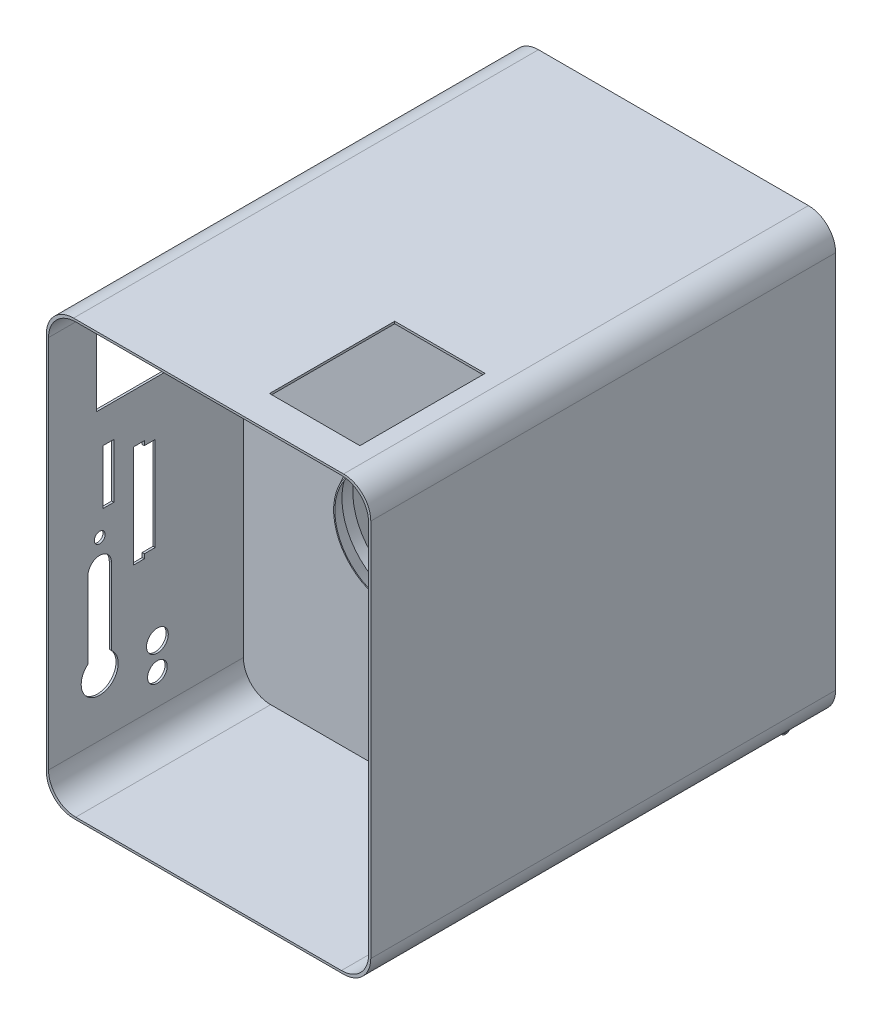
from build123d import *

# Parameters (mm, degrees)
BOSS_EXTRUDE1_DEPTH = 108.458
CUT_EXTRUDE1_DEPTH  = 108.458
BOSS_EXTRUDE2_DEPTH = 2.54
SKETCH4_R           = 14.351
CUT_EXTRUDE2_DEPTH  = 90.191983362
CUT_EXTRUDE3_REACH  = 155.02
SKETCH7_W           = 21.082
SKETCH7_H           = 29.21
CUT_EXTRUDE4_REACH  = 143.589
SKETCH8_W           = 29.21
SKETCH8_H           = 21.082
CUT_EXTRUDE5_REACH  = 143.589
SKETCH9_W           = 2.54
SKETCH9_H           = 12.7
SKETCH9_R           = 1.27
SKETCH9_R_2         = 2.286
SKETCH9_R_3         = 2.54
SKETCH12_R          = 1.27
BOSS_EXTRUDE3_DEPTH = 75.692
SKETCH13_W          = 7.0582536
SKETCH13_H          = 4.079848454
SKETCH13_W_2        = 7.112
SKETCH13_W_3        = 6.949562238
CUT_EXTRUDE11_DEPTH = 12.7
SKETCH15_R          = 1.016
CUT_EXTRUDE12_DEPTH = 140.500120645


# Read off the part's stored shape, not the designer's step: Loft-Thin1
with BuildPart() as part:
    # Sketch1 → Boss-Extrude1 (new body)
    with BuildSketch(Plane.XY):
        with BuildLine():
            Line((-31.496, -50.546), (31.496, -50.546))
            ThreePointArc((31.496, -50.546), (35.986128061, -48.686128061), (37.846, -44.196))
            Line((37.846, -44.196), (37.846, 44.196))
            ThreePointArc((37.846, 44.196), (35.986128061, 48.686128061), (31.496, 50.546))
            Line((31.496, 50.546), (-31.496, 50.546))
            ThreePointArc((-31.496, 50.546), (-35.986128061, 48.686128061), (-37.846, 44.196))
            Line((-37.846, 44.196), (-37.846, -44.196))
            ThreePointArc((-37.846, -44.196), (-35.986128061, -48.686128061), (-31.496, -50.546))
        make_face()
    extrude(amount=-BOSS_EXTRUDE1_DEPTH)

    # Sketch2 → Cut-Extrude1 (cut)
    with BuildSketch(Plane.XY):
        with BuildLine():
            Line((-30.988, -50.038), (30.988, -50.038))
            ThreePointArc((30.988, -50.038), (35.478128061, -48.178128061), (37.338, -43.688))
            Line((37.338, -43.688), (37.338, 43.688))
            ThreePointArc((37.338, 43.688), (35.478128061, 48.178128061), (30.988, 50.038))
            Line((30.988, 50.038), (-30.988, 50.038))
            ThreePointArc((-30.988, 50.038), (-35.478128061, 48.178128061), (-37.338, 43.688))
            Line((-37.338, 43.688), (-37.338, -43.688))
            ThreePointArc((-37.338, -43.688), (-35.478128061, -48.178128061), (-30.988, -50.038))
        make_face()
    extrude(amount=-CUT_EXTRUDE1_DEPTH, mode=Mode.SUBTRACT)

    # Sketch3 → Boss-Extrude2 (add)
    with BuildSketch(Plane.XY.offset(-45.466)):
        with BuildLine():
            Line((-30.988, -50.038), (30.988, -50.038))
            ThreePointArc((30.988, -50.038), (35.478128061, -48.178128061), (37.338, -43.688))
            Line((37.338, -43.688), (37.338, 43.688))
            ThreePointArc((37.338, 43.688), (35.478128061, 48.178128061), (30.988, 50.038))
            Line((30.988, 50.038), (-30.988, 50.038))
            ThreePointArc((-30.988, 50.038), (-35.478128061, 48.178128061), (-37.338, 43.688))
            Line((-37.338, 43.688), (-37.338, -43.688))
            ThreePointArc((-37.338, -43.688), (-35.478128061, -48.178128061), (-30.988, -50.038))
        make_face()
    extrude(amount=-BOSS_EXTRUDE2_DEPTH)

    # Sketch4 → Cut-Extrude2 (cut, through all)
    with BuildSketch(Plane.XY.offset(-45.466)):
        Circle(SKETCH4_R)
    extrude(amount=-CUT_EXTRUDE2_DEPTH, mode=Mode.SUBTRACT)

    # Loft-Thin1 outline → Loft-Thin1 (revolve)
    with BuildSketch(Plane.XZ):
        Polygon((12.983980633, -42.164), (12.7, -42.164), (14.351, -45.466), (14.634980633, -45.466), align=None)
    revolve(axis=Axis((0, 0, 0), (0, 0, 1)))

    # Sketch7 → Cut-Extrude3 (cut, up to next)
    with BuildSketch(Plane(origin=(0, 50.546, 0), x_dir=(1, 0, 0), z_dir=(0, 1, 0)), mode=Mode.PRIVATE) as cut_extrude3_sk1:
        with Locations((17.145, 22.225)):
            Rectangle(SKETCH7_W, SKETCH7_H)
    cut_extrude3_tool1 = extrude(cut_extrude3_sk1.sketch, amount=-CUT_EXTRUDE3_REACH, mode=Mode.PRIVATE) & part.part
    add(cut_extrude3_tool1.solids().sort_by_distance((17.145, 50.546, -22.225))[0], mode=Mode.SUBTRACT)

    # Sketch8 → Cut-Extrude4 (cut, up to next)
    with BuildSketch(Plane.ZY.offset(37.846), mode=Mode.PRIVATE) as cut_extrude4_sk1:
        with Locations((-25.781, 33.655)):
            Rectangle(SKETCH8_W, SKETCH8_H)
    cut_extrude4_tool1 = extrude(cut_extrude4_sk1.sketch, amount=-CUT_EXTRUDE4_REACH, mode=Mode.PRIVATE) & part.part
    add(cut_extrude4_tool1.solids().sort_by_distance((-37.846, 33.655, -25.781))[0], mode=Mode.SUBTRACT)

    # Sketch9 → Cut-Extrude5 (cut, up to next)
    with BuildSketch(Plane.ZY.offset(37.846), mode=Mode.PRIVATE) as cut_extrude5_sk1:
        with Locations((-13.97, 9.144)):
            Rectangle(SKETCH9_W, SKETCH9_H)
    cut_extrude5_tool1 = extrude(cut_extrude5_sk1.sketch, amount=-CUT_EXTRUDE5_REACH, mode=Mode.PRIVATE) & part.part
    # Sketch9 → Cut-Extrude5 (cut, up to next)
    with BuildSketch(Plane.ZY.offset(37.846), mode=Mode.PRIVATE) as cut_extrude5_sk2:
        Polygon((-24.892, -11.176), (-22.352, -11.176), (-22.352, -12.192), (-19.812, -12.192), (-19.812, 11.684), (-22.352, 11.684), (-22.352, 10.668), (-24.892, 10.668), align=None)
    cut_extrude5_tool2 = extrude(cut_extrude5_sk2.sketch, amount=-CUT_EXTRUDE5_REACH, mode=Mode.PRIVATE) & part.part
    # Sketch9 → Cut-Extrude5 (cut, up to next)
    with BuildSketch(Plane.ZY.offset(37.846), mode=Mode.PRIVATE) as cut_extrude5_sk3:
        with BuildLine():
            Line((-9.201161122, -26.88611423), (-9.201161122, -9.029677755))
            ThreePointArc((-9.201161122, -9.029677755), (-11.938, -6.292838878), (-14.674838878, -9.029677755))
            Line((-14.674838878, -9.029677755), (-14.674838878, -26.88611423))
            ThreePointArc((-14.674838878, -26.88611423), (-14.991287081, -33.279287081), (-8.59811423, -32.962838878))
            ThreePointArc((-8.59811423, -32.962838878), (-7.641106794, -29.799581453), (-9.201161122, -26.88611423))
        make_face()
    cut_extrude5_tool3 = extrude(cut_extrude5_sk3.sketch, amount=-CUT_EXTRUDE5_REACH, mode=Mode.PRIVATE) & part.part
    # Sketch9 → Cut-Extrude5 (cut, up to next)
    with BuildSketch(Plane.ZY.offset(37.846), mode=Mode.PRIVATE) as cut_extrude5_sk4:
        with Locations((-11.938, -2.679677755)):
            Circle(SKETCH9_R)
    cut_extrude5_tool4 = extrude(cut_extrude5_sk4.sketch, amount=-CUT_EXTRUDE5_REACH, mode=Mode.PRIVATE) & part.part
    # Sketch9 → Cut-Extrude5 (cut, up to next)
    with BuildSketch(Plane.ZY.offset(37.846), mode=Mode.PRIVATE) as cut_extrude5_sk5:
        with Locations((-25.4, -36.576)):
            Circle(SKETCH9_R_2)
    cut_extrude5_tool5 = extrude(cut_extrude5_sk5.sketch, amount=-CUT_EXTRUDE5_REACH, mode=Mode.PRIVATE) & part.part
    # Sketch9 → Cut-Extrude5 (cut, up to next)
    with BuildSketch(Plane.ZY.offset(37.846), mode=Mode.PRIVATE) as cut_extrude5_sk6:
        with Locations((-25.4, -30.226)):
            Circle(SKETCH9_R_3)
    cut_extrude5_tool6 = extrude(cut_extrude5_sk6.sketch, amount=-CUT_EXTRUDE5_REACH, mode=Mode.PRIVATE) & part.part
    add(cut_extrude5_tool1.solids().sort_by_distance((-37.846, 9.144, -13.97))[0], mode=Mode.SUBTRACT)
    add(cut_extrude5_tool2.solids().sort_by_distance((-37.846, -0.254, -22.295556))[0], mode=Mode.SUBTRACT)
    add(cut_extrude5_tool3.solids().sort_by_distance((-37.846, -21.416514, -11.938))[0], mode=Mode.SUBTRACT)
    add(cut_extrude5_tool4.solids().sort_by_distance((-37.846, -2.679678, -11.938))[0], mode=Mode.SUBTRACT)
    add(cut_extrude5_tool5.solids().sort_by_distance((-37.846, -36.576, -25.4))[0], mode=Mode.SUBTRACT)
    add(cut_extrude5_tool6.solids().sort_by_distance((-37.846, -30.226, -25.4))[0], mode=Mode.SUBTRACT)


with BuildPart() as body_2:
    # Sketch12 → Boss-Extrude3 (new body)
    with BuildSketch(Plane(origin=(37.846, 0, 0), x_dir=(0, 0, -1), z_dir=(1, 0, 0))):
        with Locations((102.616, -51.816)):
            Circle(SKETCH12_R)
    extrude(amount=-BOSS_EXTRUDE3_DEPTH)

    # Sketch13 → Cut-Extrude11 (cut)
    with BuildSketch(Plane(origin=(0, 0, -108.458), x_dir=(-1, 0, 0), z_dir=(0, 0, -1))):
        with Locations((-35.5331268, -52.585924227)):
            Rectangle(SKETCH13_W, SKETCH13_H)
        with Locations((-21.336, -52.585924227)):
            Rectangle(SKETCH13_W_2, SKETCH13_H)
        with Locations((-7.112, -52.585924227)):
            Rectangle(SKETCH13_W_2, SKETCH13_H)
        with Locations((7.112, -52.585924227)):
            Rectangle(SKETCH13_W_2, SKETCH13_H)
        with Locations((21.336, -52.585924227)):
            Rectangle(SKETCH13_W_2, SKETCH13_H)
        with Locations((35.478781119, -52.585924227)):
            Rectangle(SKETCH13_W_3, SKETCH13_H)
    extrude(amount=-CUT_EXTRUDE11_DEPTH, mode=Mode.SUBTRACT)


with BuildPart() as cut_extrude11_piece_1:
    # of the separate pieces the step leaves, piece 1, a body of its own (cut_extrude11_pieces)
    add(body_2.part.solids().sort_by_distance((32.004, -51.816, -103.886))[0])


with BuildPart() as cut_extrude11_piece_2:
    # of the separate pieces the step leaves, piece 2, a body of its own (cut_extrude11_pieces)
    add(body_2.part.solids().sort_by_distance((-24.892, -51.816, -103.886))[0])


with BuildPart() as cut_extrude11_piece_3:
    # of the separate pieces the step leaves, piece 3, a body of its own (cut_extrude11_pieces)
    add(body_2.part.solids().sort_by_distance((3.556, -51.816, -103.886))[0])


with BuildPart() as cut_extrude11_piece_4:
    # of the separate pieces the step leaves, piece 4, a body of its own (cut_extrude11_pieces)
    add(body_2.part.solids().sort_by_distance((17.78, -51.816, -103.886))[0])


with BuildPart() as cut_extrude11_piece_5:
    # of the separate pieces the step leaves, piece 5, a body of its own (cut_extrude11_pieces)
    add(body_2.part.solids().sort_by_distance((-10.668, -51.816, -103.886))[0])


with BuildPart() as cut_extrude12_tool:
    # Sketch15 → Cut-Extrude12 (new, through all)
    with BuildSketch(Plane.ZY.offset(32.004)):
        with Locations((-102.616, -51.816)):
            Circle(SKETCH15_R)
    extrude(amount=-CUT_EXTRUDE12_DEPTH)


with BuildPart() as cut_extrude11_piece_1_1:
    add(cut_extrude11_piece_1.part)

    # Cut-Extrude12: cut by cut_extrude12_tool
    add(cut_extrude12_tool.part, mode=Mode.SUBTRACT)


with BuildPart() as cut_extrude11_piece_2_1:
    add(cut_extrude11_piece_2.part)

    # Cut-Extrude12: cut by cut_extrude12_tool
    add(cut_extrude12_tool.part, mode=Mode.SUBTRACT)


with BuildPart() as cut_extrude11_piece_3_1:
    add(cut_extrude11_piece_3.part)

    # Cut-Extrude12: cut by cut_extrude12_tool
    add(cut_extrude12_tool.part, mode=Mode.SUBTRACT)


with BuildPart() as cut_extrude11_piece_4_1:
    add(cut_extrude11_piece_4.part)

    # Cut-Extrude12: cut by cut_extrude12_tool
    add(cut_extrude12_tool.part, mode=Mode.SUBTRACT)


with BuildPart() as cut_extrude11_piece_5_1:
    add(cut_extrude11_piece_5.part)

    # Cut-Extrude12: cut by cut_extrude12_tool
    add(cut_extrude12_tool.part, mode=Mode.SUBTRACT)


solid = Compound([part.part, cut_extrude11_piece_1_1.part, cut_extrude11_piece_2_1.part, cut_extrude11_piece_3_1.part, cut_extrude11_piece_4_1.part, cut_extrude11_piece_5_1.part])
